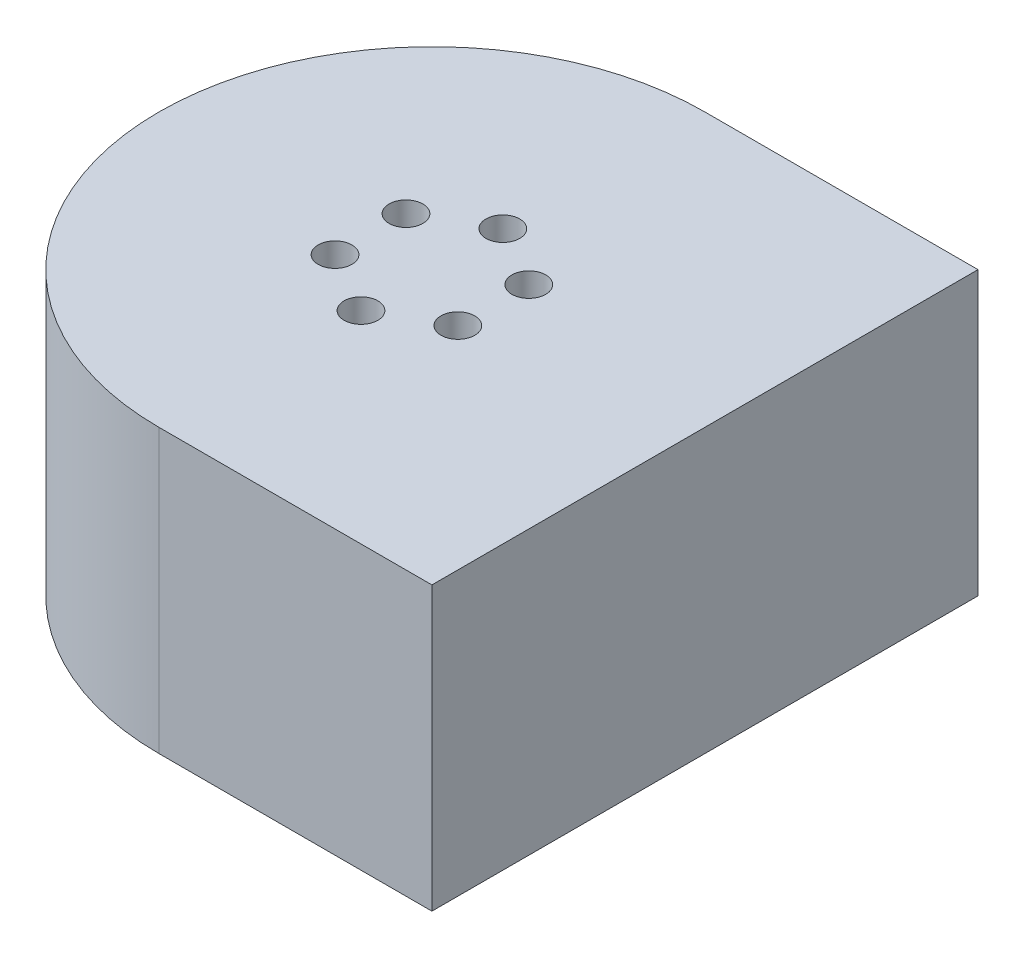
from build123d import *

# Parameters (mm, degrees)
BOSS_EXTRUDE1_DEPTH = 46
SKETCH2_R           = 2.75
CUT_EXTRUDE2_DEPTH  = 76


with BuildPart() as part:
    # Sketch1 → Boss-Extrude1 (new body)
    with BuildSketch(Plane(origin=(0, 0, 0), x_dir=(1, 0, 0), z_dir=(0, 1, 0))):
        with BuildLine():
            Line((0, 44.45), (44.45, 44.45))
            Line((44.45, 44.45), (44.45, -44.45))
            Line((44.45, -44.45), (0, -44.45))
            ThreePointArc((0, -44.45), (-44.45, 0), (0, 44.45))
        make_face()
    extrude(amount=BOSS_EXTRUDE1_DEPTH)

    # Sketch2 → Cut-Extrude2 (cut)
    with BuildSketch(Plane(origin=(0, 0, 0), x_dir=(-1, 0, 0), z_dir=(0, -1, 0))):
        with Locations((0, -11.547005384)):
            Circle(SKETCH2_R)
        with Locations((10, -5.773502692)):
            Circle(SKETCH2_R)
        with Locations((-10, -5.773502692)):
            Circle(SKETCH2_R)
        with Locations((10, 5.773502692)):
            Circle(SKETCH2_R)
        with Locations((-10, 5.773502692)):
            Circle(SKETCH2_R)
        with Locations((0, 11.547005384)):
            Circle(SKETCH2_R)
    extrude(amount=-CUT_EXTRUDE2_DEPTH, mode=Mode.SUBTRACT)


solid = part.part
